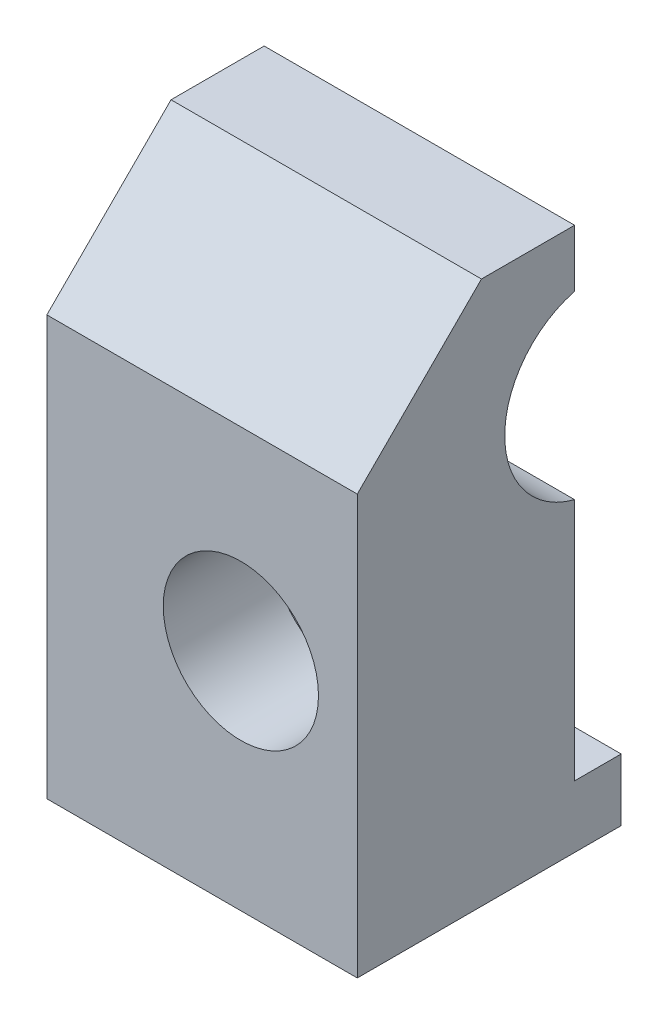
from build123d import *
from build123d.topology import SkipClean

# Parameters (mm, degrees)
SKETCH1_W           = 30
SKETCH1_H           = 59
SKETCH1_R           = 7
BOSS_EXTRUDE1_DEPTH = 30
CUT_EXTRUDE1_START  = -14.5
SKETCH2_W           = 30
SKETCH2_H           = 2
CUT_EXTRUDE1_DEPTH  = 4
BOSS_EXTRUDE2_START = 12
SKETCH4_W           = 45
SKETCH4_H           = 59
SKETCH4_R           = 7
BOSS_EXTRUDE2_DEPTH = 12
SKETCH5_R           = 8
CUT_EXTRUDE3_DEPTH  = 8.5
SKETCH8_R           = 10
CUT_EXTRUDE5_DEPTH  = 3.5
BOSS_EXTRUDE4_START = 1.5
BOSS_EXTRUDE4_DEPTH = 1.5
SKETCH12_R          = 6
CUT_EXTRUDE7_DEPTH  = 22
CHAMFER1_SIZE       = 2
MOVE_FACE1_BY       = 1
SKETCH16_W          = 1
SKETCH16_H          = 8
BOSS_EXTRUDE5_DEPTH = 15
SKETCH14_R          = 2.25
CUT_EXTRUDE9_DEPTH  = 70.083283072
BOSS_EXTRUDE6_DEPTH = 20
SKETCH18_R          = 5
CUT_EXTRUDE10_DEPTH = 3
SKETCH19_R          = 2.25
CUT_EXTRUDE11_DEPTH = 81.873357789
SKETCH20_R          = 5
CUT_EXTRUDE12_DEPTH = 7
CHAMFER2_SIZE       = 8
CUT_EXTRUDE13_DEPTH = 2
SKETCH22_R          = 3.3
CUT_EXTRUDE14_DEPTH = 15
CUT_EXTRUDE15_START = -3
CUT_EXTRUDE15_DEPTH = 7
SKETCH24_W          = 8
SKETCH24_H          = 4
SKETCH24_W_2        = 4
SKETCH24_H_2        = 8
BOSS_EXTRUDE7_DEPTH = 4
CUT_EXTRUDE16_START = -31.5
CUT_EXTRUDE16_DEPTH = 31.5


with BuildPart() as part:
    # Sketch1 → Boss-Extrude1 (new body)
    with BuildSketch(Plane.XY):
        with Locations((0, -15)):
            Rectangle(SKETCH1_W, SKETCH1_H)
        Circle(SKETCH1_R, mode=Mode.SUBTRACT)
    extrude(amount=-BOSS_EXTRUDE1_DEPTH)

    # Sketch2 → Cut-Extrude1 (cut, symmetric)
    with BuildSketch(Plane.XZ.offset(44.5).offset(CUT_EXTRUDE1_START)):
        with Locations((0, -29)):
            Rectangle(SKETCH2_W, SKETCH2_H)
    extrude(amount=CUT_EXTRUDE1_DEPTH, both=True, mode=Mode.SUBTRACT)

    # Sketch4 → Boss-Extrude2 (add)
    with BuildSketch(Plane.XY.offset(BOSS_EXTRUDE2_START)):
        with Locations((7.5, -15)):
            Rectangle(SKETCH4_W, SKETCH4_H)
        Circle(SKETCH4_R, mode=Mode.SUBTRACT)
    extrude(amount=-BOSS_EXTRUDE2_DEPTH)

    # Sketch5 → Cut-Extrude3 (cut)
    with BuildSketch(Plane.XY.offset(12)):
        Circle(SKETCH5_R)
    extrude(amount=-CUT_EXTRUDE3_DEPTH, mode=Mode.SUBTRACT)

    # Sketch8 → Cut-Extrude5 (cut)
    with BuildSketch(Plane.XY.offset(12)):
        Circle(SKETCH8_R)
    extrude(amount=-CUT_EXTRUDE5_DEPTH, mode=Mode.SUBTRACT)

    # Sketch11 → Boss-Extrude4 (add)
    with SkipClean():  # the faces are left unmerged after this step: merging them gives an invalid solid
        with BuildSketch(Plane.XY.offset(12).offset(BOSS_EXTRUDE4_START)):
            with BuildLine():
                Line((30, 14.5), (8, 14.5))
                Line((8, 14.5), (8, 6))
                ThreePointArc((8, 6), (10, 0), (8, -6))
                Line((8, -6), (8, -44.5))
                Line((8, -44.5), (30, -44.5))
                Line((30, -44.5), (30, 14.5))
            make_face()
        extrude(amount=-BOSS_EXTRUDE4_DEPTH)

    # Sketch12 → Cut-Extrude7 (cut)
    with SkipClean():  # the faces are left unmerged after this step: merging them gives an invalid solid
        with BuildSketch(Plane(origin=(30, 0, 0), x_dir=(0, 0, -1), z_dir=(1, 0, 0))):
            with Locations((-15, -19)):
                Circle(SKETCH12_R)
        extrude(amount=-CUT_EXTRUDE7_DEPTH, mode=Mode.SUBTRACT)

    # Chamfer1
    # the kernel refuses this chamfer: 2 mm, written as the material it adds along each edge
    with BuildSketch(Plane(origin=(8, -19.052786447, 12), x_dir=(-0.9996219169112968, 0, -0.027495876610586487), z_dir=(0, -1, 0))) as chamfer1_piece_1_section:
        Polygon((CHAMFER1_SIZE * 0.999621916911, -CHAMFER1_SIZE * 0.0274958766106), (-CHAMFER1_SIZE * 0.0274958766106, -CHAMFER1_SIZE * 0.999621916911), (0, 0), align=None)
    chamfer1_piece_1 = extrude(amount=25.447213553, mode=Mode.PRIVATE)
    chamfer1_piece_1 = chamfer1_piece_1 - Plane(origin=(7.298262976, -19, 15), x_dir=(0, 0, -1), z_dir=(1, 0, 0)) * Cylinder(6, 59, mode=Mode.PRIVATE)
    chamfer1_piece_1 = split(chamfer1_piece_1, bisect_by=Plane(origin=(7.298262976, -34.489945177, 13.5), z_dir=(0, 0, -1)), keep=Keep.TOP, mode=Mode.PRIVATE)
    add(chamfer1_piece_1)
    with BuildSketch(Plane(origin=(8, 14.5, 12), x_dir=(-0.9996219169112968, 0, -0.027495876610586487), z_dir=(0, -1, 0))) as chamfer1_piece_2_section:
        Polygon((CHAMFER1_SIZE * 0.999621916911, -CHAMFER1_SIZE * 0.0274958766106), (-CHAMFER1_SIZE * 0.0274958766106, -CHAMFER1_SIZE * 0.999621916911), (0, 0), align=None)
    chamfer1_piece_2 = extrude(amount=13.643365976, mode=Mode.PRIVATE)
    chamfer1_piece_2 = chamfer1_piece_2 - Plane(origin=(0, 0, 12.610971558), x_dir=(1, 0, 0), z_dir=(0, 0, 1)) * Cylinder(10, 36, mode=Mode.PRIVATE)
    chamfer1_piece_2 = split(chamfer1_piece_2, bisect_by=Plane(origin=(7.329577736, 10.634975656, 13.5), z_dir=(0, 0, -1)), keep=Keep.TOP, mode=Mode.PRIVATE)
    add(chamfer1_piece_2)
    with BuildSketch(Plane(origin=(8, -0.856634024, 12), x_dir=(-0.9996219169112968, 0, -0.027495876610586487), z_dir=(0, -1, 0))) as chamfer1_piece_3_section:
        Polygon((CHAMFER1_SIZE * 0.999621916911, -CHAMFER1_SIZE * 0.0274958766106), (-CHAMFER1_SIZE * 0.0274958766106, -CHAMFER1_SIZE * 0.999621916911), (0, 0), align=None)
    chamfer1_piece_3 = extrude(amount=18.090579529, mode=Mode.PRIVATE)
    chamfer1_piece_3 = chamfer1_piece_3 - Plane(origin=(7.328722349, -19, 15), x_dir=(0, 0, -1), z_dir=(1, 0, 0)) * Cylinder(6, 45, mode=Mode.PRIVATE)
    chamfer1_piece_3 = chamfer1_piece_3 - Plane(origin=(0, 0, 12.602221716), x_dir=(1, 0, 0), z_dir=(0, 0, 1)) * Cylinder(10, 45, mode=Mode.PRIVATE)
    chamfer1_piece_3 = split(chamfer1_piece_3, bisect_by=Plane(origin=(7.328722349, -10.144229593, 13.5), z_dir=(0, 0, -1)), keep=Keep.TOP, mode=Mode.PRIVATE)
    add(chamfer1_piece_3)

    # Move Face1: a face moved outward by 1.0
    extrude(part.faces().sort_by_distance((8, -19, 10.769879029))[0], amount=MOVE_FACE1_BY, dir=(1, 0, 0))

    # Sketch16 → Boss-Extrude5 (add)
    with BuildSketch(Plane(origin=(30, 0, 0), x_dir=(0, 0, -1), z_dir=(1, 0, 0))):
        with Locations((0.5, 0)):
            Rectangle(SKETCH16_W, SKETCH16_H)
        with Locations((0.5, -30)):
            Rectangle(SKETCH16_W, SKETCH16_H)
    extrude(amount=-BOSS_EXTRUDE5_DEPTH)

    # Sketch14 → Cut-Extrude9 (cut, through all)
    with BuildSketch(Plane.XY.offset(13.5)):
        with Locations((22.5, 0)):
            Circle(SKETCH14_R)
        with Locations((22.5, -30)):
            Circle(SKETCH14_R)
    extrude(amount=-CUT_EXTRUDE9_DEPTH, mode=Mode.SUBTRACT)

    # Sketch18 → Cut-Extrude10 (cut)
    with BuildSketch(Plane.XY.offset(13.5)):
        with Locations((22.5, 0)):
            Circle(SKETCH18_R)
    extrude(amount=-CUT_EXTRUDE10_DEPTH, mode=Mode.SUBTRACT)

    # Sketch21 → Cut-Extrude13 (cut)
    with BuildSketch(Plane(origin=(15, 0, 0), x_dir=(0, 0, -1), z_dir=(1, 0, 0))):
        Polygon((0, 9), (10, 9), (10, -9), (0, -9), (0, -4), (1, -4), (1, 4), (0, 4), align=None)
        Polygon((0, -21), (10, -21), (10, -39), (0, -39), (0, -34), (1, -34), (1, -26), (0, -26), align=None)
    extrude(amount=-CUT_EXTRUDE13_DEPTH, mode=Mode.SUBTRACT)

    # Sketch22 → Cut-Extrude14 (cut)
    with BuildSketch(Plane(origin=(0, 0, -28), x_dir=(-1, 0, 0), z_dir=(0, 0, -1))):
        with Locations((-0.001598667, -30)):
            Circle(SKETCH22_R)
    extrude(amount=-CUT_EXTRUDE14_DEPTH, mode=Mode.SUBTRACT)

    # Sketch23 → Cut-Extrude15 (cut)
    with BuildSketch(Plane(origin=(0, 0, -28), x_dir=(-1, 0, 0), z_dir=(0, 0, -1)).offset(CUT_EXTRUDE15_START)):
        Polygon((-5.101598667, -32.944486373), (-5.101598667, -44.5), (5.098401333, -44.5), (5.098401333, -32.944486373), (5.098401333, -27.055513627), (-0.001598667, -24.111027254), (-5.101598667, -27.055513627), align=None)
    extrude(amount=-CUT_EXTRUDE15_DEPTH, mode=Mode.SUBTRACT)

    # Sketch24 → Boss-Extrude7 (add)
    with BuildSketch(Plane(origin=(15, 0, 0), x_dir=(0, 0, -1), z_dir=(1, 0, 0))):
        with Locations((15, 12.5)):
            Rectangle(SKETCH24_W, SKETCH24_H)
        with Locations((28, 0)):
            Rectangle(SKETCH24_W_2, SKETCH24_H_2)
    extrude(amount=BOSS_EXTRUDE7_DEPTH)

    # Sketch25 → Cut-Extrude16 (cut)
    with BuildSketch(Plane(origin=(0, 0, -30), x_dir=(-1, 0, 0), z_dir=(0, 0, -1)).offset(CUT_EXTRUDE16_START)):
        with BuildLine():
            Line((-8.191520443, 5.735764364), (-12.207745888, 0))
            Line((-12.207745888, 0), (-8.191520443, -5.735764364))
            ThreePointArc((-8.191520443, -5.735764364), (10, 0), (-8.191520443, 5.735764364))
        make_face()
    extrude(amount=CUT_EXTRUDE16_DEPTH, mode=Mode.SUBTRACT)


with BuildPart() as body_2:
    # Sketch17 → Boss-Extrude6 (new body)
    with BuildSketch(Plane(origin=(30, 0, 0), x_dir=(0, 0, -1), z_dir=(1, 0, 0))):
        with BuildLine():
            Line((-16.5, -13.190524981), (-16.5, -9.5))
            Line((-16.5, -9.5), (-30.5, -9.5))
            Line((-30.5, -9.5), (-30.5, -44.5))
            Line((-30.5, -44.5), (-13.5, -44.5))
            Line((-13.5, -44.5), (-13.5, -40.5))
            Line((-13.5, -40.5), (-16.5, -40.5))
            Line((-16.5, -40.5), (-16.5, -24.809475019))
            ThreePointArc((-16.5, -24.809475019), (-21, -19), (-16.5, -13.190524981))
        make_face()
    extrude(amount=-BOSS_EXTRUDE6_DEPTH)

    # Sketch19 → Cut-Extrude11 (cut, through all)
    with BuildSketch(Plane.XY.offset(30.5)):
        with Locations((22.5, -30)):
            Circle(SKETCH19_R)
    extrude(amount=-CUT_EXTRUDE11_DEPTH, mode=Mode.SUBTRACT)

    # Sketch20 → Cut-Extrude12 (cut)
    with BuildSketch(Plane.XY.offset(30.5)):
        with Locations((22.5, -30)):
            Circle(SKETCH20_R)
    extrude(amount=-CUT_EXTRUDE12_DEPTH, mode=Mode.SUBTRACT)

    # Chamfer2
    chamfer2_edges = [body_2.edges().sort_by_distance(p)[0] for p in [
        (20, -9.5, 30.5),
    ]]
    chamfer(chamfer2_edges, length=CHAMFER2_SIZE)


solid = body_2.part
